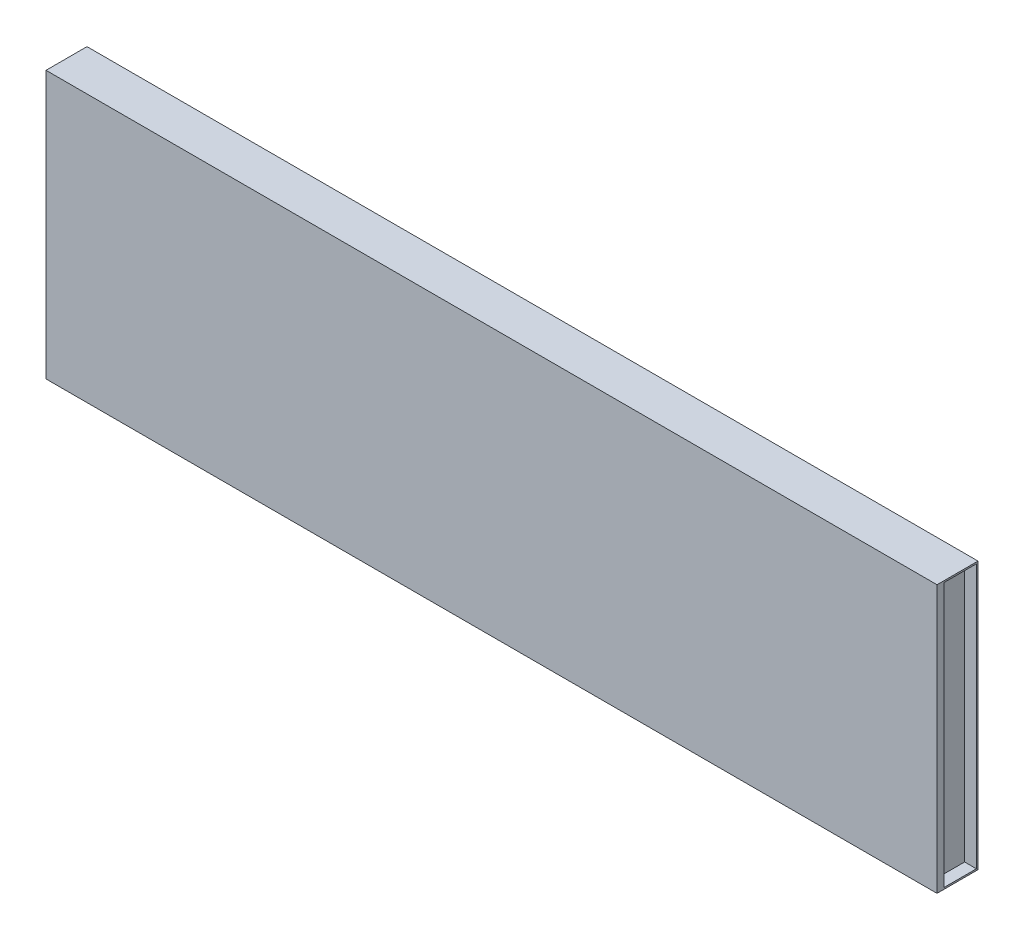
from build123d import *

# Parameters (mm, degrees)
SKETCH_1_W          = 5000
SKETCH_1_H          = 1500
EXTRUDE_1_DEPTH     = 30
EXTRUDE_2_DEPTH     = 1500
EXTRUDE_3_REACH     = 5218.234
EXTRUDE_4_REACH     = 5168.168
SKETCH_5_W          = 130
SKETCH_5_H          = 10
FILLET_2_R          = 80
SKETCH_6_R          = 30
CUT_EXTRUDE_1_DEPTH = 1355
SCALE_1_SCALE       = 0.345


with BuildPart() as part:
    # 草图1 → 凸台-拉伸1 (new body)
    with BuildSketch(Plane.XY):
        with Locations((2446.443283418, -722.784179357)):
            Rectangle(SKETCH_1_W, SKETCH_1_H)
    extrude(amount=EXTRUDE_1_DEPTH)

    # 草图3 → 凸台-拉伸2 (add)
    with BuildSketch(Plane(origin=(0, 27.215820643, 0), x_dir=(1, 0, 0), z_dir=(0, 1, 0))):
        Polygon((-53.556716582, 0), (21.443283418, 0), (21.443283418, 200), (-53.556716582, 200), (-53.556716582, 191), (12.443283418, 191), (12.443283418, 9), (-53.556716582, 9), align=None)
        Polygon((4946.443283418, 9), (4946.443283418, 0), (4871.443283418, 0), (4871.443283418, 200), (4946.443283418, 200), (4946.443283418, 191), (4880.443283418, 191), (4880.443283418, 9), align=None)
    extrude(amount=-EXTRUDE_2_DEPTH)

    # 凸台-拉伸3: up to this face of the body (flat: up to its plane)
    extrude_3_end = Plane(part.part.faces().sort_by_distance((-53.556716582, -722.784179357, 10.5))[0])
    # 草图4 → 凸台-拉伸3 (add, up to the picked face)
    with BuildSketch(Plane(origin=(4946.443283418, 0, 0), x_dir=(0, 0, -1), z_dir=(1, 0, 0)), mode=Mode.PRIVATE) as extrude_3_sk1:
        Polygon((200, 27.215820643), (0, 27.215820643), (0, -47.784179357), (9, -47.784179357), (9, 18.215820643), (191, 18.215820643), (191, -47.784179357), (200, -47.784179357), align=None)
    extrude_3_tool1 = split(extrude(extrude_3_sk1.sketch, amount=-EXTRUDE_3_REACH, mode=Mode.PRIVATE), bisect_by=extrude_3_end, keep=Keep.BOTH, mode=Mode.PRIVATE)
    # 草图4 → 凸台-拉伸3 (add, up to the picked face)
    with BuildSketch(Plane(origin=(4946.443283418, 0, 0), x_dir=(0, 0, -1), z_dir=(1, 0, 0)), mode=Mode.PRIVATE) as extrude_3_sk2:
        Polygon((9, -1397.784179357), (0, -1397.784179357), (0, -1472.784179357), (200, -1472.784179357), (200, -1397.784179357), (191, -1397.784179357), (191, -1463.784179357), (9, -1463.784179357), align=None)
    extrude_3_tool2 = split(extrude(extrude_3_sk2.sketch, amount=-EXTRUDE_3_REACH, mode=Mode.PRIVATE), bisect_by=extrude_3_end, keep=Keep.BOTH, mode=Mode.PRIVATE)
    add(extrude_3_tool1.solids().sort_by(Axis((4946.443283, 25.07982, -100), (-1, 0, 0)))[0])
    add(extrude_3_tool2.solids().sort_by(Axis((4946.443283, -1399.92018, -4.5), (-1, 0, 0)))[0])

    # 凸台-拉伸4: up to this face of the body (flat: up to its plane)
    extrude_4_end = Plane(part.part.faces().sort_by_distance((2446.443283418, -722.784179357, 0))[0])
    # 草图5 → 凸台-拉伸4 (add, up to the picked face)
    with BuildSketch(Plane(origin=(0, 0, -200), x_dir=(-1, 0, 0), z_dir=(0, 0, -1)), mode=Mode.PRIVATE) as extrude_4_sk1:
        with Locations((-86.443283418, -52.784179357)):
            Rectangle(SKETCH_5_W, SKETCH_5_H)
    extrude_4_tool1 = split(extrude(extrude_4_sk1.sketch, amount=-EXTRUDE_4_REACH, mode=Mode.PRIVATE), bisect_by=extrude_4_end, keep=Keep.BOTH, mode=Mode.PRIVATE)
    # 草图5 → 凸台-拉伸4 (add, up to the picked face)
    with BuildSketch(Plane(origin=(0, 0, -200), x_dir=(-1, 0, 0), z_dir=(0, 0, -1)), mode=Mode.PRIVATE) as extrude_4_sk2:
        with Locations((-86.443283418, -174.784179357)):
            Rectangle(SKETCH_5_W, SKETCH_5_H)
    extrude_4_tool2 = split(extrude(extrude_4_sk2.sketch, amount=-EXTRUDE_4_REACH, mode=Mode.PRIVATE), bisect_by=extrude_4_end, keep=Keep.BOTH, mode=Mode.PRIVATE)
    # 草图5 → 凸台-拉伸4 (add, up to the picked face)
    with BuildSketch(Plane(origin=(0, 0, -200), x_dir=(-1, 0, 0), z_dir=(0, 0, -1)), mode=Mode.PRIVATE) as extrude_4_sk3:
        with Locations((-86.443283418, -1270.784179357)):
            Rectangle(SKETCH_5_W, SKETCH_5_H)
    extrude_4_tool3 = split(extrude(extrude_4_sk3.sketch, amount=-EXTRUDE_4_REACH, mode=Mode.PRIVATE), bisect_by=extrude_4_end, keep=Keep.BOTH, mode=Mode.PRIVATE)
    # 草图5 → 凸台-拉伸4 (add, up to the picked face)
    with BuildSketch(Plane(origin=(0, 0, -200), x_dir=(-1, 0, 0), z_dir=(0, 0, -1)), mode=Mode.PRIVATE) as extrude_4_sk4:
        with Locations((-86.443283418, -1392.784179357)):
            Rectangle(SKETCH_5_W, SKETCH_5_H)
    extrude_4_tool4 = split(extrude(extrude_4_sk4.sketch, amount=-EXTRUDE_4_REACH, mode=Mode.PRIVATE), bisect_by=extrude_4_end, keep=Keep.BOTH, mode=Mode.PRIVATE)
    add(extrude_4_tool1.solids().sort_by(Axis((86.443283, -52.784179, -200), (0, 0, 1)))[0])
    add(extrude_4_tool2.solids().sort_by(Axis((86.443283, -174.784179, -200), (0, 0, 1)))[0])
    add(extrude_4_tool3.solids().sort_by(Axis((86.443283, -1270.784179, -200), (0, 0, 1)))[0])
    add(extrude_4_tool4.solids().sort_by(Axis((86.443283, -1392.784179, -200), (0, 0, 1)))[0])

    # 圆角2
    # the kernel refuses this fillet: 80 mm, written as the material it takes off along each edge
    with BuildSketch(Plane(origin=(151.443283418, -47.784179357, -200), x_dir=(-1, 0, 0), z_dir=(0, -1, 0))) as fillet_2_piece_1:
        with BuildLine():
            CenterArc((FILLET_2_R, -FILLET_2_R), FILLET_2_R, 90, 90)
            Line((0, -FILLET_2_R), (0, 0))
            Line((0, 0), (FILLET_2_R, 0))
        make_face()
    extrude(amount=210, mode=Mode.SUBTRACT)
    with BuildSketch(Plane(origin=(151.443283418, 30.215820643, -200), x_dir=(-1, 0, 0), z_dir=(0, -1, 0))) as fillet_2_piece_2_section:
        with BuildLine():
            CenterArc((FILLET_2_R, -FILLET_2_R), FILLET_2_R, 90, 90)
            Line((0, -FILLET_2_R), (0, 0))
            Line((0, 0), (FILLET_2_R, 0))
        make_face()
    fillet_2_piece_2 = extrude(amount=410, mode=Mode.PRIVATE)
    fillet_2_piece_2 = split(fillet_2_piece_2, bisect_by=Plane(origin=(123.199877996, -47.784179357, -195.897838893), z_dir=(0, -1, 0)), keep=Keep.TOP, mode=Mode.PRIVATE)
    add(fillet_2_piece_2, mode=Mode.SUBTRACT)
    with BuildSketch(Plane(origin=(151.443283418, -1065.784179357, -200), x_dir=(-1, 0, 0), z_dir=(0, -1, 0))) as fillet_2_piece_3_section:
        with BuildLine():
            CenterArc((FILLET_2_R, -FILLET_2_R), FILLET_2_R, 90, 90)
            Line((0, -FILLET_2_R), (0, 0))
            Line((0, 0), (FILLET_2_R, 0))
        make_face()
    fillet_2_piece_3 = extrude(amount=410, mode=Mode.PRIVATE)
    fillet_2_piece_3 = split(fillet_2_piece_3, bisect_by=Plane(origin=(123.199877996, -1397.784179357, -195.897838893), z_dir=(0, 1, 0)), keep=Keep.TOP, mode=Mode.PRIVATE)
    add(fillet_2_piece_3, mode=Mode.SUBTRACT)
    with BuildSketch(Plane(origin=(151.443283418, -1397.784179357, -200), x_dir=(-1, 0, 0), z_dir=(0, 1, 0))) as fillet_2_piece_4:
        with BuildLine():
            CenterArc((FILLET_2_R, FILLET_2_R), FILLET_2_R, 180, 90)
            Line((0, FILLET_2_R), (0, 0))
            Line((0, 0), (FILLET_2_R, 0))
        make_face()
    extrude(amount=210, mode=Mode.SUBTRACT)

    # 草图6 → 切除-拉伸1 (cut)
    with BuildSketch(Plane(origin=(0, -47.784179357, 0), x_dir=(1, 0, 0), z_dir=(0, 1, 0))):
        with Locations(Location((101.443283418, 120, 0), (0, 0, 270))):
            Circle(SKETCH_6_R)
    extrude(amount=-CUT_EXTRUDE_1_DEPTH, mode=Mode.SUBTRACT)


with BuildPart() as part_1:
    # 缩放比例1: scaled about (0, 0, 0)
    add(part.part.scale(SCALE_1_SCALE))


solid = part_1.part
